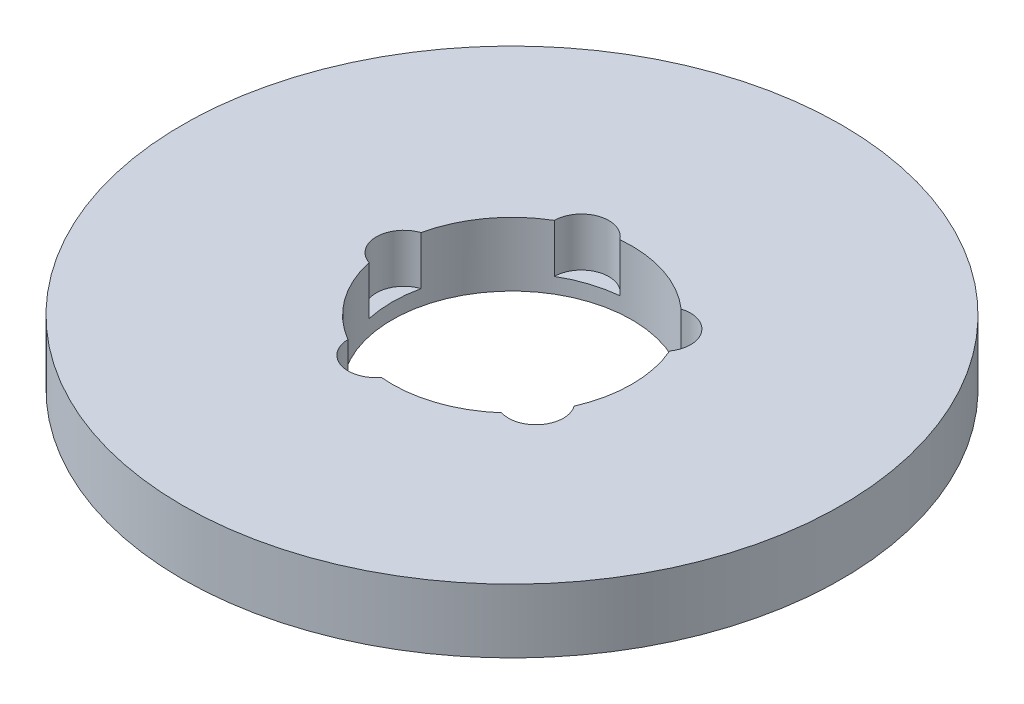
from build123d import *

# Parameters (mm, degrees)
SKETCH1_R           = 82.5
BOSS_EXTRUDE1_DEPTH = 16
SKETCH2_R           = 30
CUT_EXTRUDE1_DEPTH  = 118.764595698
SKETCH3_R           = 6.872447182
CUT_EXTRUDE2_DEPTH  = 12.156124671
CIRPATTERN1_COUNT   = 5


with BuildPart() as part:
    # Sketch1 → Boss-Extrude1 (new body)
    with BuildSketch(Plane(origin=(0, 0, 0), x_dir=(1, 0, 0), z_dir=(0, 1, 0))):
        Circle(SKETCH1_R)
    extrude(amount=BOSS_EXTRUDE1_DEPTH)

    # Sketch2 → Cut-Extrude1 (cut, through all)
    with BuildSketch(Plane(origin=(0, 0, 0), x_dir=(1, 0, 0), z_dir=(0, 1, 0))):
        Circle(SKETCH2_R)
    extrude(amount=CUT_EXTRUDE1_DEPTH, mode=Mode.SUBTRACT)

    # Sketch3 → Cut-Extrude2 (cut)
    with BuildSketch(Plane(origin=(0, 16, 0), x_dir=(1, 0, 0), z_dir=(0, 1, 0))):
        with Locations((-27.081941905, 0)):
            Circle(SKETCH3_R)
    cut_extrude2 = extrude(amount=-CUT_EXTRUDE2_DEPTH, mode=Mode.SUBTRACT)

    # CirPattern1: Cut-Extrude2 ×5 about axis
    cirpattern1_axis = Axis((0, 0, 0), (0, 1, 0))
    for i in range(1, CIRPATTERN1_COUNT):
        add(cut_extrude2.rotate(cirpattern1_axis, i * 360 / CIRPATTERN1_COUNT), mode=Mode.SUBTRACT)


solid = part.part
